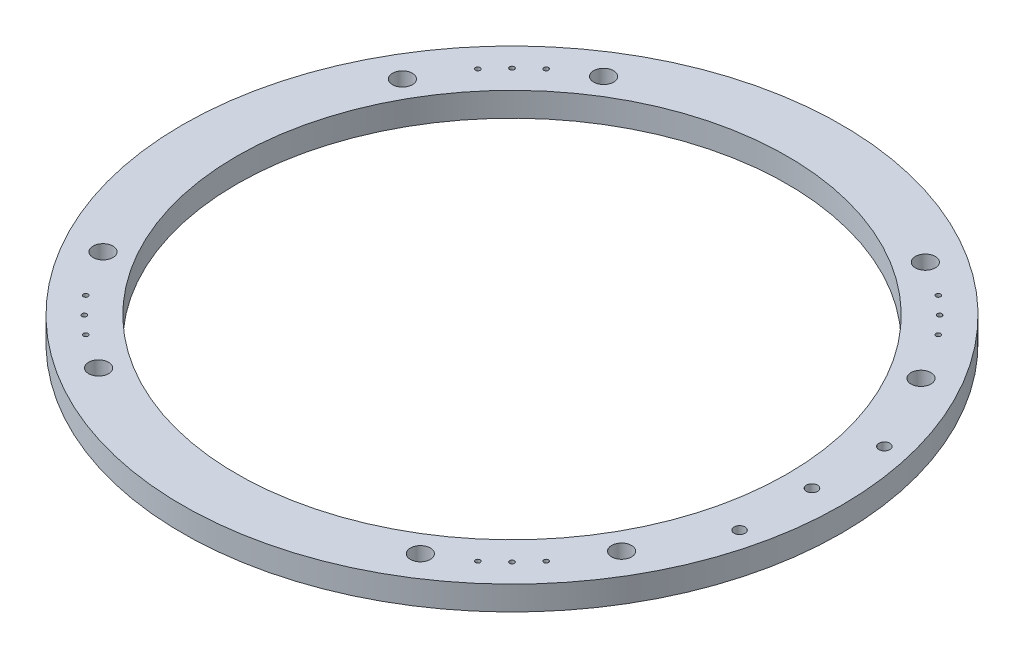
from build123d import *

# Parameters (mm, degrees)
TAP_DRILL_FOR_M3X0_5_TAP1_D = 2.5
CIRPATTERN1_COUNT           = 4
M5_CLEARANCE_HOLE1_D        = 5.8
Z_0_413_DIAMETER_HOLE1_D    = 10.4902


with BuildPart() as part:
    # Sketch1 → Revolve1 (revolve)
    with BuildSketch(Plane.XY):
        Polygon((144.787154908, 1022.5532), (144.787154908, 1009.8532), (152.4, 1009.8532), (173.362154908, 1009.8532), (173.362154908, 1022.5532), align=None)
    revolve(axis=Axis((0, 1125.81516809, 0), (0, -1, 0)))

    # Tap Drill for M3x0.5 Tap1 (through all)
    with Locations(Plane(origin=(0, 1009.8532, 0), x_dir=(-1, 0, 0), z_dir=(0, -1, 0))):
        with Locations((103.143460893, 121.103973135), (121.103973135, 103.143460893), (112.482767201, 112.482767201)):
            tap_drill_for_m3x0_5_tap1 = Hole(TAP_DRILL_FOR_M3X0_5_TAP1_D / 2)

    # CirPattern1: Tap Drill for M3x0.5 Tap1 ×4 about axis
    cirpattern1_axis = Axis((0, 1125.81516809, 0), (0, 1, 0))
    for i in range(1, CIRPATTERN1_COUNT):
        add(tap_drill_for_m3x0_5_tap1.rotate(cirpattern1_axis, i * 360 / CIRPATTERN1_COUNT), mode=Mode.SUBTRACT)

    # M5 Clearance Hole1 (through all)
    with Locations(Plane(origin=(0, 1022.5532, 0), x_dir=(1, 0, 0), z_dir=(0, 1, 0))):
        with Locations((157.7975, -38.1), (157.7975, 0), (157.7975, 38.1)):
            Hole(M5_CLEARANCE_HOLE1_D / 2)

    # Z (0.413) Diameter Hole1 (through all)
    with Locations(Plane(origin=(0, 1022.5532, 0), x_dir=(1, 0, 0), z_dir=(0, 1, 0))):
        with Locations((-136.38787692, -78.743577454), (136.38787692, -78.743577454), (136.38787692, 78.743577454), (-136.38787692, 78.743577454), (-84.617786652, 132.823319275), (84.617786652, 132.823319275), (84.617786652, -132.823319275), (-84.617786652, -132.823319275)):
            Hole(Z_0_413_DIAMETER_HOLE1_D / 2)


solid = part.part
